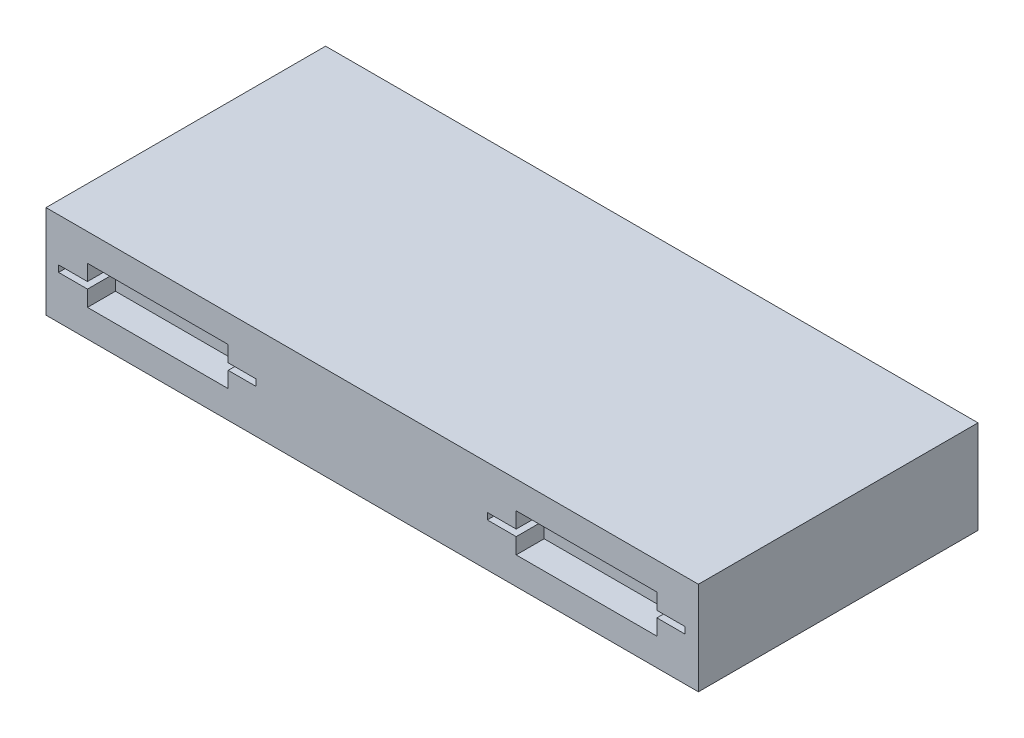
from build123d import *

# Parameters (mm, degrees)
SKETCH2_W           = 700
SKETCH2_H           = 300
BOSS_EXTRUDE1_DEPTH = 100
CUT_EXTRUDE2_DEPTH  = 30
CUT_EXTRUDE3_DEPTH  = 30


with BuildPart() as part:
    # Sketch2 → Boss-Extrude1 (new body)
    with BuildSketch(Plane(origin=(0, 0, 0), x_dir=(1, 0, 0), z_dir=(0, 1, 0))):
        with Locations((100, 0)):
            Rectangle(SKETCH2_W, SKETCH2_H)
    extrude(amount=BOSS_EXTRUDE1_DEPTH)

    # Sketch4 → Cut-Extrude2 (cut)
    with BuildSketch(Plane(origin=(0, 0, -150), x_dir=(-1, 0, 0), z_dir=(0, 0, -1))):
        Polygon((-435.5, 53.5), (-405.5, 53.5), (-405.5, 70.5), (-254.5, 70.5), (-254.5, 53.5), (-223.5, 53.5), (-223.5, 46.5), (-254.5, 46.5), (-254.5, 29.5), (-405.5, 29.5), (-405.5, 46.5), (-435.5, 46.5), align=None)
    cut_extrude2 = extrude(amount=-CUT_EXTRUDE2_DEPTH, mode=Mode.SUBTRACT)

    # Sketch5 → Cut-Extrude3 (cut)
    with BuildSketch(Plane(origin=(0, 0, -150), x_dir=(-1, 0, 0), z_dir=(0, 0, -1))):
        Polygon((24.5, 53.5), (54.5, 53.5), (54.5, 70.5), (205.5, 70.5), (205.5, 53.5), (236.5, 53.5), (236.5, 46.5), (205.5, 46.5), (205.5, 29.5), (54.5, 29.5), (54.5, 46.5), (24.5, 46.5), align=None)
    cut_extrude3 = extrude(amount=-CUT_EXTRUDE3_DEPTH, mode=Mode.SUBTRACT)

    # Mirror1: Cut-Extrude2, Cut-Extrude3 across plane
    add(cut_extrude2.mirror(Plane.XY), mode=Mode.SUBTRACT)
    add(cut_extrude3.mirror(Plane.XY), mode=Mode.SUBTRACT)


solid = part.part
